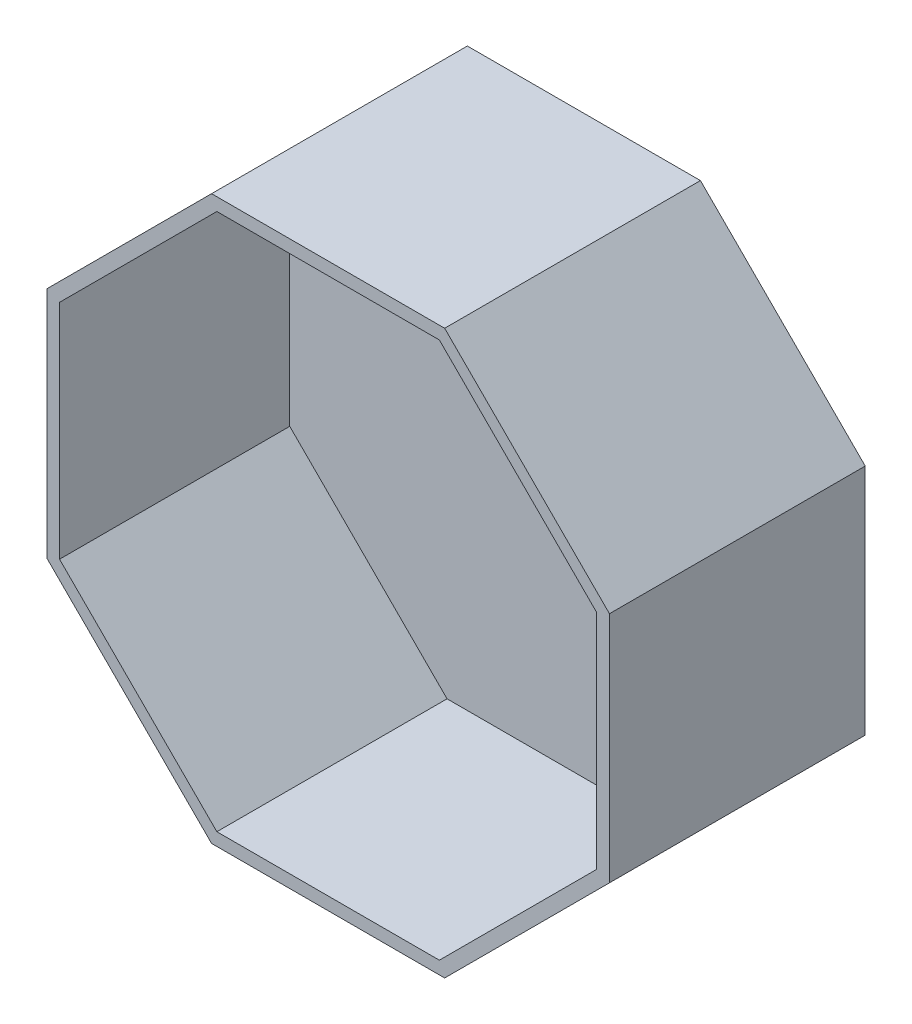
from build123d import *

# Parameters (mm, degrees)
BOSS_EXTRUDE3_DEPTH = 50
CUT_EXTRUDE3_DEPTH  = 45


with BuildPart() as part:
    # Sketch8 → Boss-Extrude3 (new body)
    with BuildSketch(Plane.XY):
        Polygon((55, 22.781745931), (22.781745931, 55), (-22.781745931, 55), (-55, 22.781745931), (-55, -22.781745931), (-22.781745931, -55), (22.781745931, -55), (55, -22.781745931), align=None)
    extrude(amount=BOSS_EXTRUDE3_DEPTH)

    # Sketch9 → Cut-Extrude3 (cut)
    with BuildSketch(Plane.XY.offset(50)):
        Polygon((52.5, 21.746212025), (21.746212025, 52.5), (-21.746212025, 52.5), (-52.5, 21.746212025), (-52.5, -21.746212025), (-21.746212025, -52.5), (21.746212025, -52.5), (52.5, -21.746212025), align=None)
    extrude(amount=-CUT_EXTRUDE3_DEPTH, mode=Mode.SUBTRACT)


solid = part.part
